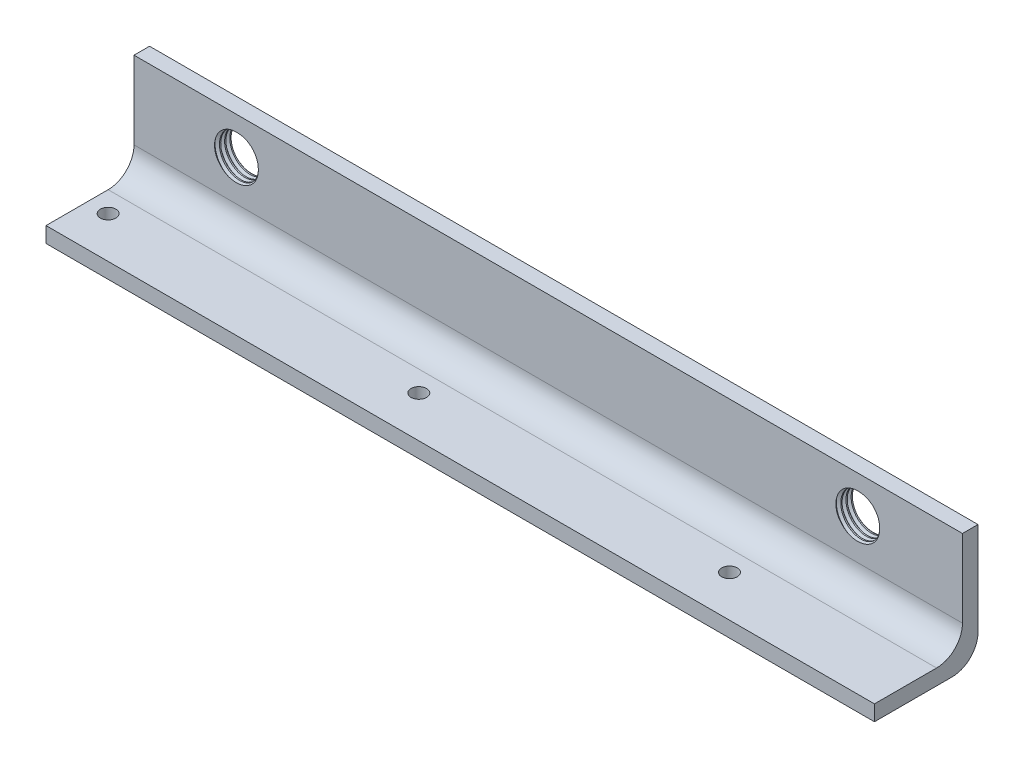
from build123d import *

# Parameters (mm, degrees)
SKETCH1_W           = 160
SKETCH1_H           = 20
BOSS_EXTRUDE1_DEPTH = 3
SKETCH2_W           = 160
SKETCH2_H           = 3
BOSS_EXTRUDE2_DEPTH = 20
FILLET1_R           = 5
SKETCH3_R           = 1.5
CUT_EXTRUDE1_DEPTH  = 84.066238629
CUT_EXTRUDE2_REACH  = 87.61
SKETCH4_R           = 4
THREAD1_PITCH       = 1
THREAD2_PITCH       = 1
FILLET2_R           = 5


with BuildPart() as part:
    # Sketch1 → Boss-Extrude1 (new body)
    with BuildSketch(Plane(origin=(0, 0, 0), x_dir=(1, 0, 0), z_dir=(0, 1, 0))):
        Rectangle(SKETCH1_W, SKETCH1_H)
    extrude(amount=BOSS_EXTRUDE1_DEPTH)

    # Sketch2 → Boss-Extrude2 (add)
    with BuildSketch(Plane(origin=(0, 3, 0), x_dir=(1, 0, 0), z_dir=(0, 1, 0))):
        with Locations((0, 8.5)):
            Rectangle(SKETCH2_W, SKETCH2_H)
    extrude(amount=BOSS_EXTRUDE2_DEPTH)

    # Fillet1
    fillet1_edges = [part.edges().sort_by_distance(p)[0] for p in [
        (0, 3, -7),
    ]]
    fillet(fillet1_edges, radius=FILLET1_R)

    # Sketch3 → Cut-Extrude1 (cut, through all)
    with BuildSketch(Plane(origin=(0, 3, 0), x_dir=(1, 0, 0), z_dir=(0, 1, 0))):
        with Locations(Location((-76, -2, 0), (0, 0, 270))):
            Circle(SKETCH3_R)
        with Locations(Location((-16, -2, 0), (0, 0, 270))):
            Circle(SKETCH3_R)
        with Locations(Location((44, -2, 0), (0, 0, 270))):
            Circle(SKETCH3_R)
    extrude(amount=-CUT_EXTRUDE1_DEPTH, mode=Mode.SUBTRACT)

    # Sketch4 → Cut-Extrude2 (cut, up to next)
    with BuildSketch(Plane(origin=(0, 0, -10), x_dir=(-1, 0, 0), z_dir=(0, 0, -1)), mode=Mode.PRIVATE) as cut_extrude2_sk1:
        with Locations((-60, 16)):
            Circle(SKETCH4_R)
    cut_extrude2_tool1 = extrude(cut_extrude2_sk1.sketch, amount=-CUT_EXTRUDE2_REACH, mode=Mode.PRIVATE) & part.part
    # Sketch4 → Cut-Extrude2 (cut, up to next)
    with BuildSketch(Plane(origin=(0, 0, -10), x_dir=(-1, 0, 0), z_dir=(0, 0, -1)), mode=Mode.PRIVATE) as cut_extrude2_sk2:
        with Locations((60, 16)):
            Circle(SKETCH4_R)
    cut_extrude2_tool2 = extrude(cut_extrude2_sk2.sketch, amount=-CUT_EXTRUDE2_REACH, mode=Mode.PRIVATE) & part.part
    add(cut_extrude2_tool1.solids().sort_by_distance((60, 16, -10))[0], mode=Mode.SUBTRACT)
    add(cut_extrude2_tool2.solids().sort_by_distance((-60, 16, -10))[0], mode=Mode.SUBTRACT)

    # Thread1: the profile of Thread Profile1 profile screwed along a right-hand helix of 4 turns, 8 arcs to a turn; built about Z, then put on its axis
    thread1_z = Axis((0, 0, 0), (0, 0, 1))
    thread1_corners = [(3.9997, 0, -0.000173205), (4.541265875, 0, 0.312499999), (4.541265875, 0, 0.437499999), (3.9997, 0, 0.750173202)]
    with BuildLine(mode=Mode.PRIVATE) as thread1_profile:
        Line(thread1_corners[0], thread1_corners[1])
        Line(thread1_corners[1], thread1_corners[2])
        Line(thread1_corners[2], thread1_corners[3])
        Line(thread1_corners[3], thread1_corners[0])
    thread1_cap = Face(thread1_profile.wire())
    thread1_turn_angles = [0, 22.5, 45, 67.5, 90, 112.5, 135, 157.5, 180, 202.5, 225, 247.5, 270, 292.5, 315, 337.5, 360]
    thread1_turn_weights = [1, 0.9238795325112867, 1, 0.9238795325112867, 1, 0.9238795325112867, 1, 0.9238795325112867, 1, 0.9238795325112867, 1, 0.9238795325112867, 1, 0.9238795325112867, 1, 0.9238795325112867, 1]
    thread1_turn_rails = [Edge.make_bspline([Vector(p[0], p[1], 0).rotate(thread1_z, thread1_turn_angles[k]) / thread1_turn_weights[k] + Vector(0, 0, p[2] + THREAD1_PITCH * thread1_turn_angles[k] / 360) for k in range(17)], [0, 0, 0, 1, 1, 2, 2, 3, 3, 4, 4, 5, 5, 6, 6, 7, 7, 8, 8, 8], 2, thread1_turn_weights) for p in thread1_corners]
    thread1_turn_sides = [Face.make_surface_from_curves(thread1_turn_rails[p[0]], thread1_turn_rails[p[1]]) for p in [(0, 1), (1, 2), (2, 3), (3, 0)]]
    thread1 = Plane(origin=(60, 16, -11), x_dir=(1, 0, 0), z_dir=(0, 0, 1)) * Solid(Shell([*[p.moved(Location((0, 0, THREAD1_PITCH * i))) for i in range(4) for p in thread1_turn_sides], thread1_cap, thread1_cap.rotate(thread1_z, 1440).moved(Location((0, 0, THREAD1_PITCH * 1440 / 360)))]))
    add(thread1, mode=Mode.SUBTRACT)

    # Thread2: the profile of Thread Profile2 profile screwed along a right-hand helix of 4 turns, 8 arcs to a turn; built about Z, then put on its axis
    thread2_z = Axis((0, 0, 0), (0, 0, 1))
    thread2_corners = [(3.9997, 0, -0.000173205), (4.541265875, 0, 0.312499999), (4.541265875, 0, 0.437499999), (3.9997, 0, 0.750173202)]
    with BuildLine(mode=Mode.PRIVATE) as thread2_profile:
        Line(thread2_corners[0], thread2_corners[1])
        Line(thread2_corners[1], thread2_corners[2])
        Line(thread2_corners[2], thread2_corners[3])
        Line(thread2_corners[3], thread2_corners[0])
    thread2_cap = Face(thread2_profile.wire())
    thread2_turn_angles = [0, 22.5, 45, 67.5, 90, 112.5, 135, 157.5, 180, 202.5, 225, 247.5, 270, 292.5, 315, 337.5, 360]
    thread2_turn_weights = [1, 0.9238795325112867, 1, 0.9238795325112867, 1, 0.9238795325112867, 1, 0.9238795325112867, 1, 0.9238795325112867, 1, 0.9238795325112867, 1, 0.9238795325112867, 1, 0.9238795325112867, 1]
    thread2_turn_rails = [Edge.make_bspline([Vector(p[0], p[1], 0).rotate(thread2_z, thread2_turn_angles[k]) / thread2_turn_weights[k] + Vector(0, 0, p[2] + THREAD2_PITCH * thread2_turn_angles[k] / 360) for k in range(17)], [0, 0, 0, 1, 1, 2, 2, 3, 3, 4, 4, 5, 5, 6, 6, 7, 7, 8, 8, 8], 2, thread2_turn_weights) for p in thread2_corners]
    thread2_turn_sides = [Face.make_surface_from_curves(thread2_turn_rails[p[0]], thread2_turn_rails[p[1]]) for p in [(0, 1), (1, 2), (2, 3), (3, 0)]]
    thread2 = Plane(origin=(-60, 16, -11), x_dir=(1, 0, 0), z_dir=(0, 0, 1)) * Solid(Shell([*[p.moved(Location((0, 0, THREAD2_PITCH * i))) for i in range(4) for p in thread2_turn_sides], thread2_cap, thread2_cap.rotate(thread2_z, 1440).moved(Location((0, 0, THREAD2_PITCH * 1440 / 360)))]))
    add(thread2, mode=Mode.SUBTRACT)

    # Fillet2
    fillet2_edges = [part.edges().sort_by_distance(p)[0] for p in [
        (0, 0, -10),
    ]]
    fillet(fillet2_edges, radius=FILLET2_R)


solid = part.part
